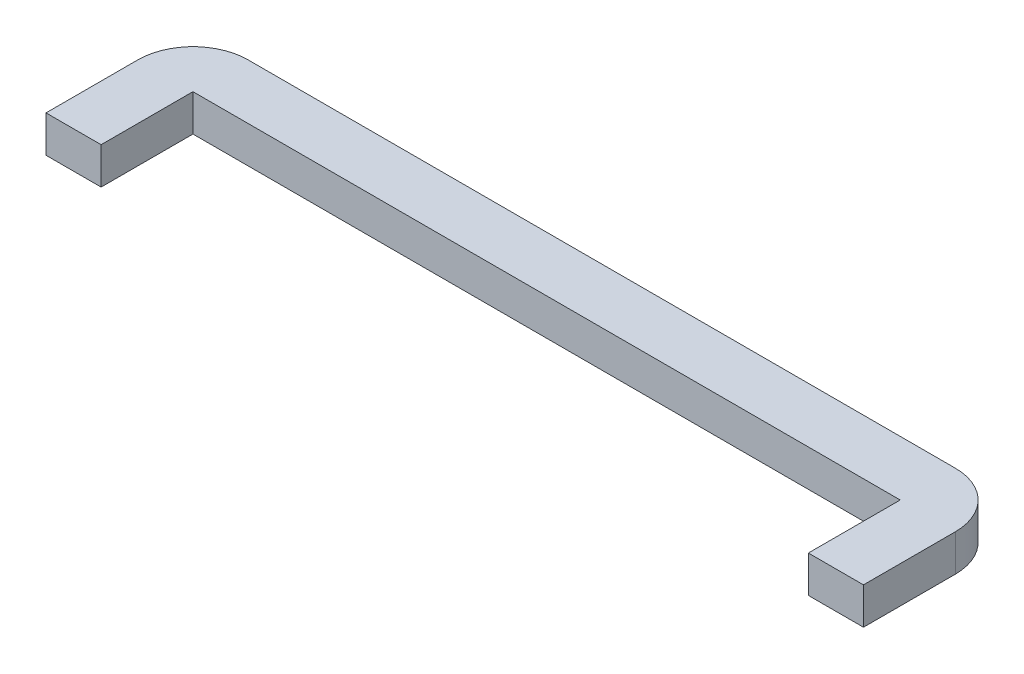
from build123d import *

# Parameters (mm, degrees)
BOSS_EXTRUDE1_DEPTH = 1
FILLET1_R           = 3


with BuildPart() as part:
    # Sketch1 → Boss-Extrude1 (new, symmetric)
    with BuildSketch(Plane(origin=(0, 0, 0), x_dir=(1, 0, 0), z_dir=(0, 1, 0))):
        Polygon((-22.25, 1.5), (-22.25, -6.5), (-19.25, -6.5), (-19.25, -1.5), (19.25, -1.5), (19.25, -6.5), (22.25, -6.5), (22.25, 1.5), align=None)
    extrude(amount=BOSS_EXTRUDE1_DEPTH, both=True)

    # Fillet1
    fillet1_edges = [part.edges().sort_by_distance(p)[0] for p in [
        (-22.25, 0, -1.5),
        (22.25, 0, -1.5),
    ]]
    fillet(fillet1_edges, radius=FILLET1_R)


solid = part.part
